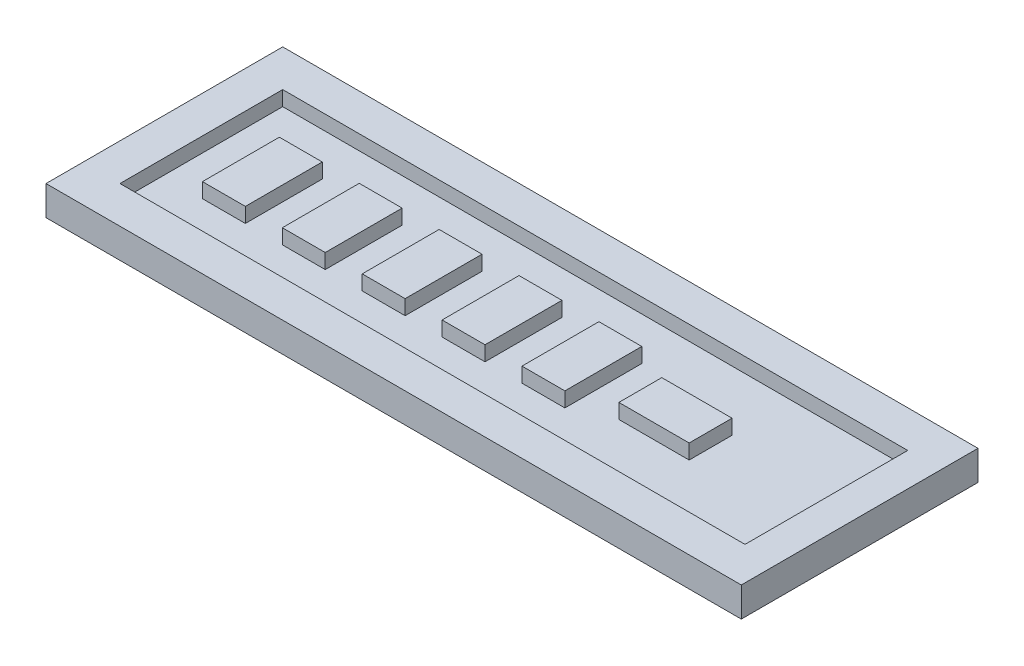
from build123d import *

# Parameters (mm, degrees)
SKETCH1_W           = 94
SKETCH1_H           = 32
BOSS_EXTRUDE1_DEPTH = 4
CAVITY1_START       = 5
CAVITY1_OUTLINE_W   = 2
CAVITY1_OUTLINE_H   = 5.8
CAVITY1_DEPTH       = 84.5
CAVITY1_START_2     = 73.85
CAVITY1_2_OUTLINE_W = 2
CAVITY1_2_OUTLINE_H = 10.4
CAVITY1_2_DEPTH     = 15.65
CAVITY1_START_3     = 59.35
CAVITY1_3_OUTLINE_W = 2
CAVITY1_3_OUTLINE_H = 2.3
CAVITY1_3_DEPTH     = 14.5
CAVITY1_4_OUTLINE_W = 2
CAVITY1_4_OUTLINE_H = 10.4
CAVITY1_4_DEPTH     = 5.35
CAVITY1_START_4     = 16.15
CAVITY1_5_OUTLINE_W = 2
CAVITY1_5_OUTLINE_H = 10.4
CAVITY1_5_DEPTH     = 5
CAVITY1_START_5     = 26.95
CAVITY1_6_OUTLINE_W = 2
CAVITY1_6_OUTLINE_H = 10.4
CAVITY1_6_DEPTH     = 5
CAVITY1_START_6     = 37.75
CAVITY1_7_OUTLINE_W = 2
CAVITY1_7_OUTLINE_H = 10.4
CAVITY1_7_DEPTH     = 5
CAVITY1_START_7     = 48.55
CAVITY1_8_OUTLINE_W = 2
CAVITY1_8_OUTLINE_H = 10.4
CAVITY1_8_DEPTH     = 5
CAVITY1_9_OUTLINE_W = 2
CAVITY1_9_OUTLINE_H = 5.8
CAVITY1_9_DEPTH     = 5


# Read off the part's stored shape, not the designer's step: Cavity1
with BuildPart() as part:
    # Sketch1 → Boss-Extrude1 (new body)
    with BuildSketch(Plane(origin=(0, 0, 0), x_dir=(1, 0, 0), z_dir=(0, 1, 0))):
        with Locations((47, 16)):
            Rectangle(SKETCH1_W, SKETCH1_H)
    extrude(amount=BOSS_EXTRUDE1_DEPTH)

    # Cavity1 outline → Cavity1 (cut)
    with BuildSketch(Plane.YZ.offset(CAVITY1_START)):
        with Locations((3, -7.9)):
            Rectangle(CAVITY1_OUTLINE_W, CAVITY1_OUTLINE_H)
        with Locations((3, -24.1)):
            Rectangle(CAVITY1_OUTLINE_W, CAVITY1_OUTLINE_H)
    extrude(amount=CAVITY1_DEPTH, mode=Mode.SUBTRACT)

    # Cavity1 2 outline → Cavity1 2 (cut)
    with BuildSketch(Plane.YZ.offset(CAVITY1_START_2)):
        with Locations((3, -16)):
            Rectangle(CAVITY1_2_OUTLINE_W, CAVITY1_2_OUTLINE_H)
    extrude(amount=CAVITY1_2_DEPTH, mode=Mode.SUBTRACT)

    # Cavity1 3 outline → Cavity1 3 (cut)
    with BuildSketch(Plane.YZ.offset(CAVITY1_START_3)):
        with Locations((3, -11.95)):
            Rectangle(CAVITY1_3_OUTLINE_W, CAVITY1_3_OUTLINE_H)
        with Locations((3, -20.05)):
            Rectangle(CAVITY1_3_OUTLINE_W, CAVITY1_3_OUTLINE_H)
    extrude(amount=CAVITY1_3_DEPTH, mode=Mode.SUBTRACT)

    # Cavity1 4 outline → Cavity1 4 (cut)
    with BuildSketch(Plane.YZ.offset(CAVITY1_START)):
        with Locations((3, -16)):
            Rectangle(CAVITY1_4_OUTLINE_W, CAVITY1_4_OUTLINE_H)
    extrude(amount=CAVITY1_4_DEPTH, mode=Mode.SUBTRACT)

    # Cavity1 5 outline → Cavity1 5 (cut)
    with BuildSketch(Plane.YZ.offset(CAVITY1_START_4)):
        with Locations((3, -16)):
            Rectangle(CAVITY1_5_OUTLINE_W, CAVITY1_5_OUTLINE_H)
    extrude(amount=CAVITY1_5_DEPTH, mode=Mode.SUBTRACT)

    # Cavity1 6 outline → Cavity1 6 (cut)
    with BuildSketch(Plane.YZ.offset(CAVITY1_START_5)):
        with Locations((3, -16)):
            Rectangle(CAVITY1_6_OUTLINE_W, CAVITY1_6_OUTLINE_H)
    extrude(amount=CAVITY1_6_DEPTH, mode=Mode.SUBTRACT)

    # Cavity1 7 outline → Cavity1 7 (cut)
    with BuildSketch(Plane.YZ.offset(CAVITY1_START_6)):
        with Locations((3, -16)):
            Rectangle(CAVITY1_7_OUTLINE_W, CAVITY1_7_OUTLINE_H)
    extrude(amount=CAVITY1_7_DEPTH, mode=Mode.SUBTRACT)

    # Cavity1 8 outline → Cavity1 8 (cut)
    with BuildSketch(Plane.YZ.offset(CAVITY1_START_7)):
        with Locations((3, -16)):
            Rectangle(CAVITY1_8_OUTLINE_W, CAVITY1_8_OUTLINE_H)
    extrude(amount=CAVITY1_8_DEPTH, mode=Mode.SUBTRACT)

    # Cavity1 9 outline → Cavity1 9 (cut)
    with BuildSketch(Plane.YZ.offset(CAVITY1_START_3)):
        with Locations((3, -16)):
            Rectangle(CAVITY1_9_OUTLINE_W, CAVITY1_9_OUTLINE_H)
    extrude(amount=CAVITY1_9_DEPTH, mode=Mode.SUBTRACT)


solid = part.part
